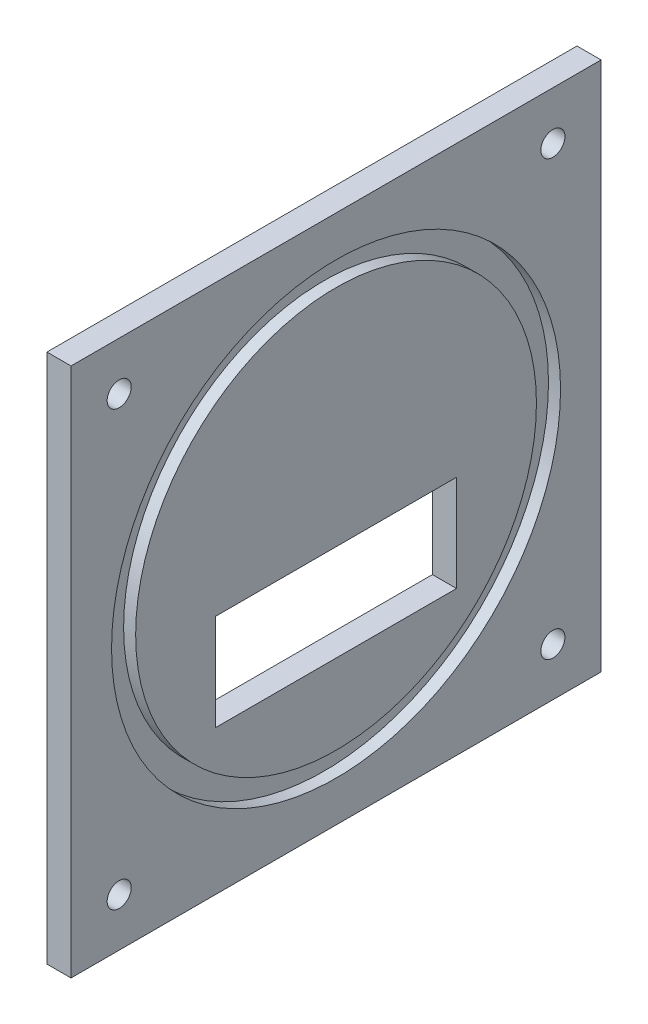
from build123d import *

# Parameters (mm, degrees)
SKETCH1_W           = 220
SKETCH1_H           = 220
SKETCH1_W_2         = 100
SKETCH1_H_2         = 40
BOSS_EXTRUDE1_DEPTH = 10
SKETCH2_R           = 93.17284
SKETCH2_R_2         = 83.17284
CUT_EXTRUDE1_DEPTH  = 5
SKETCH3_R           = 5
CUT_EXTRUDE2_DEPTH  = 312.287648325


with BuildPart() as part:
    # Sketch1 → Boss-Extrude1 (new body)
    with BuildSketch(Plane(origin=(0, 0, 0), x_dir=(0, 0, -1), z_dir=(1, 0, 0))):
        with Locations((110, 110)):
            Rectangle(SKETCH1_W, SKETCH1_H)
        with Locations((110, 80)):
            Rectangle(SKETCH1_W_2, SKETCH1_H_2, mode=Mode.SUBTRACT)
    extrude(amount=BOSS_EXTRUDE1_DEPTH)

    # Sketch2 → Cut-Extrude1 (cut)
    with BuildSketch(Plane(origin=(10, 0, 0), x_dir=(0, 0, -1), z_dir=(1, 0, 0))):
        with Locations((110, 110)):
            Circle(SKETCH2_R)
        with Locations((110, 110)):
            Circle(SKETCH2_R_2, mode=Mode.SUBTRACT)
    extrude(amount=-CUT_EXTRUDE1_DEPTH, mode=Mode.SUBTRACT)

    # Sketch3 → Cut-Extrude2 (cut, through all)
    with BuildSketch(Plane(origin=(10, 0, 0), x_dir=(0, 0, -1), z_dir=(1, 0, 0))):
        with Locations((20, 200)):
            Circle(SKETCH3_R)
        with Locations((200, 200)):
            Circle(SKETCH3_R)
        with Locations((200, 20)):
            Circle(SKETCH3_R)
        with Locations((20, 20)):
            Circle(SKETCH3_R)
    extrude(amount=-CUT_EXTRUDE2_DEPTH, mode=Mode.SUBTRACT)


solid = part.part
